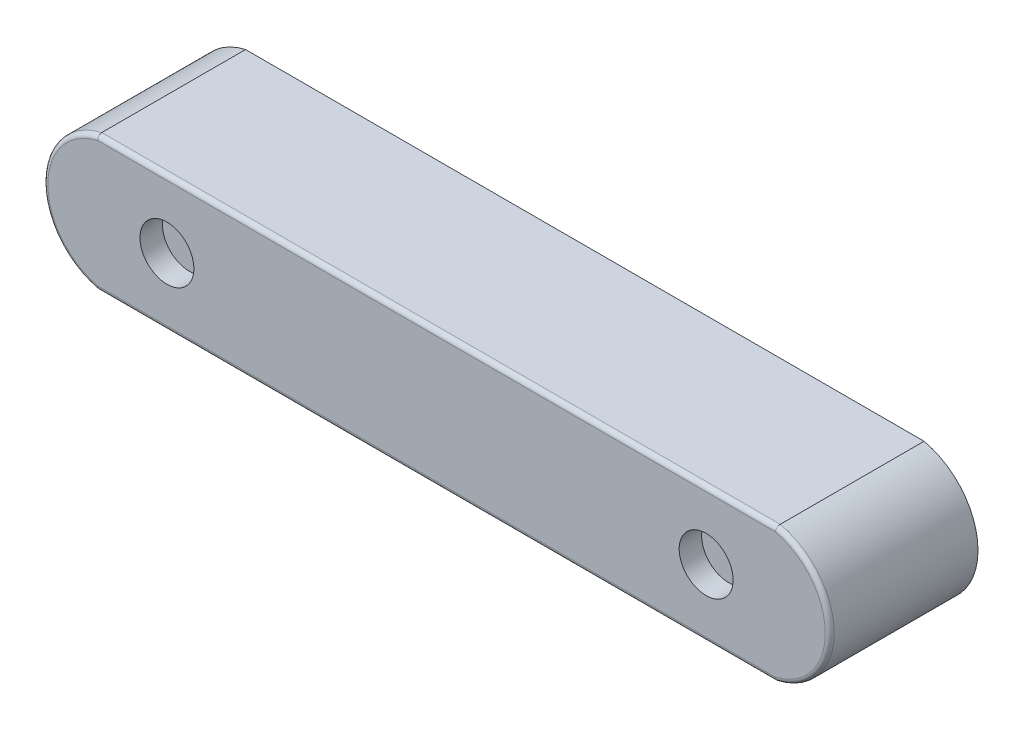
from build123d import *

# Parameters (mm, degrees)
ESTRUSIONE_ESTRUSIONE1_DEPTH = 33
RACCORDO1_R                  = 1
SCHIZZO2_R                   = 6
TAGLIO_ESTRUSIONE1_DEPTH     = 5
SCHIZZO3_R                   = 4.46
TAGLIO_ESTRUSIONE2_DEPTH     = 2
SCHIZZO4_R                   = 2.65
TAGLIO_ESTRUSIONE3_DEPTH     = 8
SCHIZZO5_R                   = 2
ESTRUSIONE_ESTRUSIONE2_DEPTH = 5


with BuildPart() as part:
    # Schizzo1 → Estrusione-Estrusione1 (new body)
    with BuildSketch(Plane.XY):
        with BuildLine():
            Line((-75.5, -15), (75.5, -15))
            ThreePointArc((75.5, -15), (87.5, 0), (75.5, 15))
            Line((75.5, 15), (-75.5, 15))
            ThreePointArc((-75.5, 15), (-87.5, 0), (-75.5, -15))
        make_face()
    extrude(amount=ESTRUSIONE_ESTRUSIONE1_DEPTH)

    # Raccordo1
    # the kernel refuses this fillet: 1 mm, written as the material it takes off along each edge
    with BuildSketch(Plane(origin=(72.125, 0, 33), x_dir=(0.05848647839975847, -0.9982882007939364, 0), z_dir=(-0.9982882007939364, -0.05848647839975847, 0))) as raccordo1_piece_1:
        with BuildLine():
            CenterArc((15.375 - RACCORDO1_R, -RACCORDO1_R), RACCORDO1_R, 0, 90)
            Line((15.375 - RACCORDO1_R, 0), (15.375, 0))
            Line((15.375, 0), (15.375, -RACCORDO1_R))
        make_face()
    revolve(axis=Axis((72.125, 0, 33), (0, 0, 1)), revolution_arc=173.294116446, mode=Mode.SUBTRACT)
    with BuildSketch(Plane(origin=(78, 15, 33), x_dir=(0, 0, -1), z_dir=(-1, 0, 0)), Plane(origin=(-78, -15, 33), x_dir=(0, 0, -1), z_dir=(1, 0, 0))) as raccordo1_piece_2:
        with BuildLine():
            CenterArc((RACCORDO1_R, RACCORDO1_R), RACCORDO1_R, 180, 90)
            Line((0, RACCORDO1_R), (0, 0))
            Line((0, 0), (RACCORDO1_R, 0))
        make_face()
    extrude(amount=156, mode=Mode.SUBTRACT)
    with BuildSketch(Plane(origin=(-72.125, 0, 33), x_dir=(-0.05848647839975752, 0.9982882007939364, 0), z_dir=(0.9982882007939364, 0.05848647839975752, 0))) as raccordo1_piece_3:
        with BuildLine():
            CenterArc((15.375 - RACCORDO1_R, -RACCORDO1_R), RACCORDO1_R, 0, 90)
            Line((15.375 - RACCORDO1_R, 0), (15.375, 0))
            Line((15.375, 0), (15.375, -RACCORDO1_R))
        make_face()
    revolve(axis=Axis((-72.125, 0, 33), (0, 0, 1)), revolution_arc=173.294116446, mode=Mode.SUBTRACT)

    # Schizzo2 → Taglio-Estrusione1 (cut)
    with BuildSketch(Plane.XY.offset(33)):
        with Locations((-60, 0)):
            Circle(SCHIZZO2_R)
        with Locations((60, 0)):
            Circle(SCHIZZO2_R)
    extrude(amount=-TAGLIO_ESTRUSIONE1_DEPTH, mode=Mode.SUBTRACT)

    # Schizzo3 → Taglio-Estrusione2 (cut)
    with BuildSketch(Plane.XZ.offset(15)):
        with Locations((0, 15.6)):
            Circle(SCHIZZO3_R)
    extrude(amount=-TAGLIO_ESTRUSIONE2_DEPTH, mode=Mode.SUBTRACT)

    # Schizzo4 → Taglio-Estrusione3 (cut)
    with BuildSketch(Plane.XZ.offset(13)):
        with Locations((0, 15.6)):
            Circle(SCHIZZO4_R)
    extrude(amount=-TAGLIO_ESTRUSIONE3_DEPTH, mode=Mode.SUBTRACT)

    # Schizzo5 → Estrusione-Estrusione2 (add)
    with BuildSketch(Plane(origin=(0, 0, 0), x_dir=(-1, 0, 0), z_dir=(0, 0, -1))):
        with Locations(Location((0, -10, 0), (0, 0, 180))):
            Circle(SCHIZZO5_R)
    extrude(amount=ESTRUSIONE_ESTRUSIONE2_DEPTH)


solid = part.part
